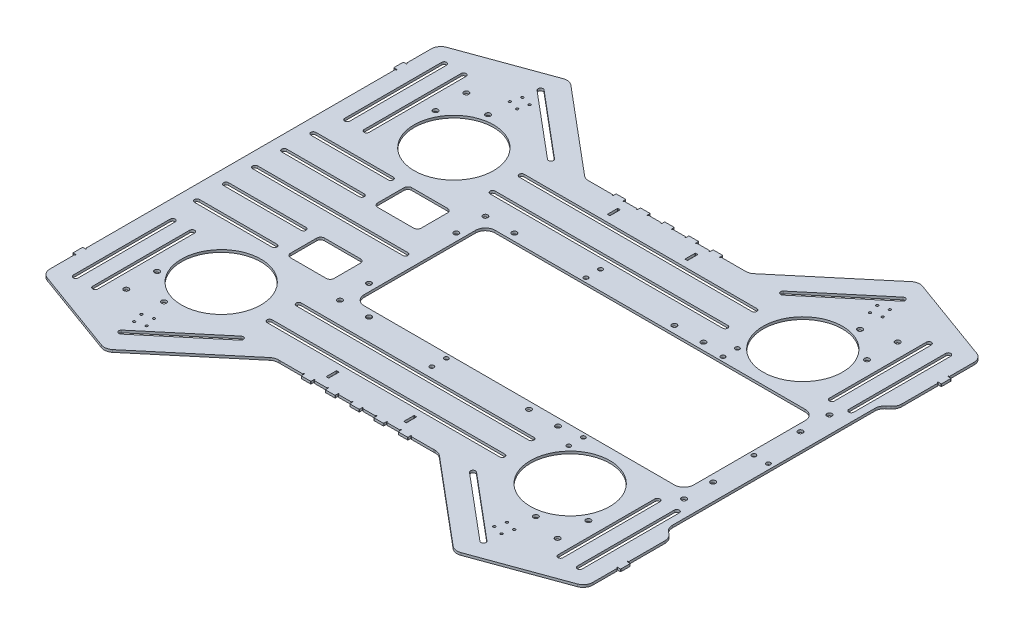
from build123d import *

# Parameters (mm, degrees)
SKETCH1_R                         = 1.575
SKETCH1_R_2                       = 52.07
SHEET_METAL_EXTRUDE_DEPTH         = 3.175
SHAPE_FILLET_R                    = 12.7
SKETCH2_R                         = 3.2639
PV_MOUNT_PATTERN_DEPTH            = 468.231899887
SKETCH3_R                         = 3.2639
THRUSTER_MOUNT_HOLE_PATTERN_DEPTH = 468.231899887
SKETCH5_W                         = 12.7
SKETCH5_H                         = 3.175
BOSS_EXTRUDE4_DEPTH               = 3.175
CUT_EXTRUDE3_DEPTH                = 468.231899887
LPATTERN1_COUNT                   = 5
LPATTERN1_PITCH                   = 31.75
MIRROR3_COPY_1_DEPTH              = 468.231899887
MIRROR3_COPY_2_DEPTH              = 468.231899887
MIRROR3_COPY_3_DEPTH              = 468.231899887
MIRROR3_COPY_4_DEPTH              = 468.231899887
FILLET_FOR_CUTTER_2_R             = 0.508
FILLET_FOR_CUTTER_R               = 0.508
CUT_EXTRUDE4_REACH                = 469.232
SKETCH8_W                         = 3.3528
SKETCH8_H                         = 13.716
FILLET3_R                         = 0.508
SKETCH9_W                         = 12.7
SKETCH9_H                         = 3.175
BOSS_EXTRUDE5_DEPTH               = 3.175
CUT_EXTRUDE5_DEPTH                = 3.175
MIRROR5_COPY_1_DEPTH              = 3.175
FILLET5_R                         = 0.508
SIDE_MOUNTING_SLOTS_DEPTH         = 470.652838698
BACK_MOUNTING_SLOTS_DEPTH         = 470.652838698
CUT_EXTRUDE8_DEPTH                = 470.652838698
MIRROR8_COPY_1_DEPTH              = 470.652838698
CUT_EXTRUDE9_DEPTH                = 470.652838698
CUT_EXTRUDE10_DEPTH               = 470.652838698
FILLET6_R                         = 0.254
FILLET6_OF_MIRROR9_R              = 0.254
MIRROR10_DEPTH                    = 3.175
CUT_EXTRUDE11_REACH               = 471.653
SKETCH16_R                        = 2.75


# Read off the part's stored shape, not the designer's step: Mirror10
with BuildPart() as part:
    # Sketch1 → Sheet Metal Extrude (new body)
    with BuildSketch(Plane(origin=(0, 0, 0), x_dir=(1, 0, 0), z_dir=(0, 1, 0))):
        Polygon((-355.6, -258.575780248), (-228.6, -304.8), (-107.517834992, -203.2), (107.517834992, -203.2), (228.6, -304.8), (355.6, -258.575780248), (355.6, -149.225), (342.9, -138.568434684), (342.9, 138.568434684), (355.6, 149.225), (355.6, 258.575780248), (228.6, 304.8), (107.517834992, 203.2), (-107.517834992, 203.2), (-228.6, 304.8), (-355.6, 258.575780248), (-355.6, 149.225), (-355.6, -149.225), align=None)
        with Locations((-240.704026872, -254.319069628)):
            Circle(SKETCH1_R, mode=Mode.SUBTRACT)
        with Locations((-227.726785536, -250.841828292)):
            Circle(SKETCH1_R, mode=Mode.SUBTRACT)
        with Locations((-244.181268208, -241.341828292)):
            Circle(SKETCH1_R, mode=Mode.SUBTRACT)
        with Locations((-231.204026872, -237.864586956)):
            Circle(SKETCH1_R, mode=Mode.SUBTRACT)
        with Locations((-228.6, -152.4)):
            Circle(SKETCH1_R_2, mode=Mode.SUBTRACT)
        with Locations((227.726785536, -250.841828292)):
            Circle(SKETCH1_R, mode=Mode.SUBTRACT)
        with Locations((240.704026872, -254.319069628)):
            Circle(SKETCH1_R, mode=Mode.SUBTRACT)
        with Locations((244.181268208, -241.341828292)):
            Circle(SKETCH1_R, mode=Mode.SUBTRACT)
        with Locations((231.204026872, -237.864586956)):
            Circle(SKETCH1_R, mode=Mode.SUBTRACT)
        with Locations((228.6, -152.4)):
            Circle(SKETCH1_R_2, mode=Mode.SUBTRACT)
        with Locations((-228.6, 152.4)):
            Circle(SKETCH1_R_2, mode=Mode.SUBTRACT)
        with Locations((-231.204026872, 237.864586956)):
            Circle(SKETCH1_R, mode=Mode.SUBTRACT)
        with Locations((-244.181268208, 241.341828292)):
            Circle(SKETCH1_R, mode=Mode.SUBTRACT)
        with Locations((-240.704026872, 254.319069628)):
            Circle(SKETCH1_R, mode=Mode.SUBTRACT)
        with Locations((-227.726785536, 250.841828292)):
            Circle(SKETCH1_R, mode=Mode.SUBTRACT)
        with Locations((228.6, 152.4)):
            Circle(SKETCH1_R_2, mode=Mode.SUBTRACT)
        with Locations((231.204026872, 237.864586956)):
            Circle(SKETCH1_R, mode=Mode.SUBTRACT)
        with Locations((244.181268208, 241.341828292)):
            Circle(SKETCH1_R, mode=Mode.SUBTRACT)
        with Locations((227.726785536, 250.841828292)):
            Circle(SKETCH1_R, mode=Mode.SUBTRACT)
        with Locations((240.704026872, 254.319069628)):
            Circle(SKETCH1_R, mode=Mode.SUBTRACT)
    extrude(amount=SHEET_METAL_EXTRUDE_DEPTH)

    # Shape Fillet
    shape_fillet_edges = [part.edges().sort_by_distance(p)[0] for p in [
        (228.6, 1.5875, -304.8),
        (355.6, 1.5875, -258.575780248),
        (355.6, 1.5875, -149.225),
        (342.9, 1.5875, -138.568434684),
        (342.9, 1.5875, 138.568434684),
        (355.6, 1.5875, 149.225),
        (355.6, 1.5875, 258.575780248),
        (228.6, 1.5875, 304.8),
        (107.517834992, 1.5875, 203.2),
        (-107.517834992, 1.5875, 203.2),
        (-228.6, 1.5875, 304.8),
        (-355.6, 1.5875, 258.575780248),
        (-355.6, 1.5875, -258.575780248),
        (-228.6, 1.5875, -304.8),
        (-107.517834992, 1.5875, -203.2),
        (107.517834992, 1.5875, -203.2),
    ]]
    fillet(shape_fillet_edges, radius=SHAPE_FILLET_R)

    # Sketch2 → PV Mount Pattern (cut, through all)
    with BuildSketch(Plane(origin=(0, 3.175, 0), x_dir=(1, 0, 0), z_dir=(0, 1, 0))):
        with Locations(Location((320.675, 95.25, 0), (0, 0, 270))):
            Circle(SKETCH2_R)
        with Locations(Location((320.675, 57.15, 0), (0, 0, 270))):
            Circle(SKETCH2_R)
        with Locations(Location((155.575, 95.25, 0), (0, 0, 270))):
            Circle(SKETCH2_R)
        with Locations(Location((117.475, 95.25, 0), (0, 0, 270))):
            Circle(SKETCH2_R)
        with Locations(Location((-92.075, 95.25, 0), (0, 0, 270))):
            Circle(SKETCH2_R)
        with Locations(Location((-130.175, 95.25, 0), (0, 0, 270))):
            Circle(SKETCH2_R)
        with Locations(Location((-130.175, 57.15, 0), (0, 0, 270))):
            Circle(SKETCH2_R)
        with Locations(Location((320.675, -57.15, 0), (0, 0, 90))):
            Circle(SKETCH2_R)
        with Locations(Location((320.675, -95.25, 0), (0, 0, 90))):
            Circle(SKETCH2_R)
        with Locations(Location((155.575, -95.25, 0), (0, 0, 90))):
            Circle(SKETCH2_R)
        with Locations(Location((117.475, -95.25, 0), (0, 0, 90))):
            Circle(SKETCH2_R)
        with Locations(Location((-92.075, -95.25, 0), (0, 0, 90))):
            Circle(SKETCH2_R)
        with Locations(Location((-130.175, -95.25, 0), (0, 0, 90))):
            Circle(SKETCH2_R)
        with Locations(Location((-130.175, -57.15, 0), (0, 0, 90))):
            Circle(SKETCH2_R)
        with BuildLine():
            Line((-107.95, 85.725), (298.45, 85.725))
            ThreePointArc((298.45, 85.725), (307.430256121, 82.005256121), (311.15, 73.025))
            Line((311.15, 73.025), (311.15, -73.025))
            ThreePointArc((311.15, -73.025), (307.430256121, -82.005256121), (298.45, -85.725))
            Line((298.45, -85.725), (-107.95, -85.725))
            ThreePointArc((-107.95, -85.725), (-116.930256121, -82.005256121), (-120.65, -73.025))
            Line((-120.65, -73.025), (-120.65, 73.025))
            ThreePointArc((-120.65, 73.025), (-116.930256121, 82.005256121), (-107.95, 85.725))
        make_face()
    extrude(amount=-PV_MOUNT_PATTERN_DEPTH, mode=Mode.SUBTRACT)

    # Sketch3 → Thruster Mount Hole Pattern (cut, through all)
    with BuildSketch(Plane(origin=(0, 3.175, 0), x_dir=(1, 0, 0), z_dir=(0, 1, 0))):
        with Locations(Location((282.589529262, 222.760524402, 0), (0, 0, 270))):
            Circle(SKETCH3_R)
        with Locations(Location((-282.589529262, 222.760524402, 0), (0, 0, 270))):
            Circle(SKETCH3_R)
        with Locations(Location((282.589529262, -222.760524402, 0), (0, 0, 90))):
            Circle(SKETCH3_R)
        with Locations(Location((-282.589529262, -222.760524402, 0), (0, 0, 90))):
            Circle(SKETCH3_R)
        with Locations(Location((282.589529262, 182.458174715, 0), (0, 0, 270))):
            Circle(SKETCH3_R)
        with Locations(Location((243.660448839, 212.329508741, 0), (0, 0, 270))):
            Circle(SKETCH3_R)
        with Locations(Location((-243.660448839, 212.329508741, 0), (0, 0, 270))):
            Circle(SKETCH3_R)
        with Locations(Location((-282.589529262, 182.458174715, 0), (0, 0, 270))):
            Circle(SKETCH3_R)
        with Locations(Location((243.660448839, -212.329508741, 0), (0, 0, 90))):
            Circle(SKETCH3_R)
        with Locations(Location((282.589529262, -182.458174715, 0), (0, 0, 90))):
            Circle(SKETCH3_R)
        with Locations(Location((-282.589529262, -182.458174715, 0), (0, 0, 90))):
            Circle(SKETCH3_R)
        with Locations(Location((-243.660448839, -212.329508741, 0), (0, 0, 90))):
            Circle(SKETCH3_R)
    extrude(amount=-THRUSTER_MOUNT_HOLE_PATTERN_DEPTH, mode=Mode.SUBTRACT)

    # Sketch5 → Boss-Extrude4 (add)
    with BuildSketch(Plane.XY.offset(203.2)):
        with Locations((0, 1.5875)):
            Rectangle(SKETCH5_W, SKETCH5_H)
        with Locations((31.75, 1.5875)):
            Rectangle(SKETCH5_W, SKETCH5_H)
        with Locations((63.5, 1.5875)):
            Rectangle(SKETCH5_W, SKETCH5_H)
        with Locations((-31.75, 1.5875)):
            Rectangle(SKETCH5_W, SKETCH5_H)
        with Locations((-63.5, 1.5875)):
            Rectangle(SKETCH5_W, SKETCH5_H)
    boss_extrude4 = extrude(amount=BOSS_EXTRUDE4_DEPTH)

    # Mirror2: Boss-Extrude4 across plane
    add(boss_extrude4.mirror(Plane.XY))

    # Sketch6 → Cut-Extrude3 (cut, through all)
    with BuildSketch(Plane(origin=(0, 3.175, 0), x_dir=(1, 0, 0), z_dir=(0, 1, 0))):
        with BuildLine():
            Line((69.85, 202.438), (69.85, 203.2))
            Line((69.85, 203.2), (70.866, 203.2))
            Line((70.866, 203.2), (70.866, 202.438))
            ThreePointArc((70.866, 202.438), (70.358, 201.93), (69.85, 202.438))
        make_face()
        with BuildLine():
            Line((56.134, 202.438), (56.134, 203.2))
            Line((56.134, 203.2), (57.15, 203.2))
            Line((57.15, 203.2), (57.15, 202.438))
            ThreePointArc((57.15, 202.438), (56.642, 201.93), (56.134, 202.438))
        make_face()
    cut_extrude3 = extrude(amount=-CUT_EXTRUDE3_DEPTH, mode=Mode.SUBTRACT)

    # LPattern1: Cut-Extrude3 ×5
    with Locations(*[(-i * LPATTERN1_PITCH, 0, 0) for i in range(1, LPATTERN1_COUNT)]):
        add(cut_extrude3, mode=Mode.SUBTRACT)

    # Mirror3: Cut-Extrude3 across plane
    add(cut_extrude3.mirror(Plane.XY), mode=Mode.SUBTRACT)

    # Mirror3 copy 1 sketch → Mirror3 copy 1 (cut, through all)
    with BuildSketch(Plane(origin=(-31.75, 3.175, 0), x_dir=(1, 0, 0), z_dir=(0, 1, 0))):
        with BuildLine():
            Line((69.85, -202.438), (69.85, -203.2))
            Line((69.85, -203.2), (70.866, -203.2))
            Line((70.866, -203.2), (70.866, -202.438))
            ThreePointArc((70.866, -202.438), (70.358, -201.93), (69.85, -202.438))
        make_face()
        with BuildLine():
            Line((56.134, -202.438), (56.134, -203.2))
            Line((56.134, -203.2), (57.15, -203.2))
            Line((57.15, -203.2), (57.15, -202.438))
            ThreePointArc((57.15, -202.438), (56.642, -201.93), (56.134, -202.438))
        make_face()
    extrude(amount=-MIRROR3_COPY_1_DEPTH, mode=Mode.SUBTRACT)

    # Mirror3 copy 2 sketch → Mirror3 copy 2 (cut, through all)
    with BuildSketch(Plane(origin=(-63.5, 3.175, 0), x_dir=(1, 0, 0), z_dir=(0, 1, 0))):
        with BuildLine():
            Line((69.85, -202.438), (69.85, -203.2))
            Line((69.85, -203.2), (70.866, -203.2))
            Line((70.866, -203.2), (70.866, -202.438))
            ThreePointArc((70.866, -202.438), (70.358, -201.93), (69.85, -202.438))
        make_face()
        with BuildLine():
            Line((56.134, -202.438), (56.134, -203.2))
            Line((56.134, -203.2), (57.15, -203.2))
            Line((57.15, -203.2), (57.15, -202.438))
            ThreePointArc((57.15, -202.438), (56.642, -201.93), (56.134, -202.438))
        make_face()
    extrude(amount=-MIRROR3_COPY_2_DEPTH, mode=Mode.SUBTRACT)

    # Mirror3 copy 3 sketch → Mirror3 copy 3 (cut, through all)
    with BuildSketch(Plane(origin=(-95.25, 3.175, 0), x_dir=(1, 0, 0), z_dir=(0, 1, 0))):
        with BuildLine():
            Line((69.85, -202.438), (69.85, -203.2))
            Line((69.85, -203.2), (70.866, -203.2))
            Line((70.866, -203.2), (70.866, -202.438))
            ThreePointArc((70.866, -202.438), (70.358, -201.93), (69.85, -202.438))
        make_face()
        with BuildLine():
            Line((56.134, -202.438), (56.134, -203.2))
            Line((56.134, -203.2), (57.15, -203.2))
            Line((57.15, -203.2), (57.15, -202.438))
            ThreePointArc((57.15, -202.438), (56.642, -201.93), (56.134, -202.438))
        make_face()
    extrude(amount=-MIRROR3_COPY_3_DEPTH, mode=Mode.SUBTRACT)

    # Mirror3 copy 4 sketch → Mirror3 copy 4 (cut, through all)
    with BuildSketch(Plane(origin=(-127, 3.175, 0), x_dir=(1, 0, 0), z_dir=(0, 1, 0))):
        with BuildLine():
            Line((69.85, -202.438), (69.85, -203.2))
            Line((69.85, -203.2), (70.866, -203.2))
            Line((70.866, -203.2), (70.866, -202.438))
            ThreePointArc((70.866, -202.438), (70.358, -201.93), (69.85, -202.438))
        make_face()
        with BuildLine():
            Line((56.134, -202.438), (56.134, -203.2))
            Line((56.134, -203.2), (57.15, -203.2))
            Line((57.15, -203.2), (57.15, -202.438))
            ThreePointArc((57.15, -202.438), (56.642, -201.93), (56.134, -202.438))
        make_face()
    extrude(amount=-MIRROR3_COPY_4_DEPTH, mode=Mode.SUBTRACT)

    # Fillet for Cutter 2
    fillet_for_cutter_2_edges = [part.edges().sort_by_distance(p)[0] for p in [
        (-6.35, 1.5875, 206.375),
        (6.35, 1.5875, 206.375),
        (-38.1, 1.5875, 206.375),
        (-25.4, 1.5875, 206.375),
        (25.4, 1.5875, 206.375),
        (38.1, 1.5875, 206.375),
        (57.15, 1.5875, 206.375),
        (69.85, 1.5875, 206.375),
        (-69.85, 1.5875, 206.375),
        (-57.15, 1.5875, 206.375),
        (70.866, 1.5875, 203.2),
        (56.134, 1.5875, 203.2),
        (39.116, 1.5875, 203.2),
        (24.384, 1.5875, 203.2),
        (7.366, 1.5875, 203.2),
        (-7.366, 1.5875, 203.2),
        (-24.384, 1.5875, 203.2),
        (-39.116, 1.5875, 203.2),
        (-56.134, 1.5875, 203.2),
        (-70.866, 1.5875, 203.2),
    ]]
    fillet(fillet_for_cutter_2_edges, radius=FILLET_FOR_CUTTER_2_R)

    # Fillet for Cutter
    fillet_for_cutter_edges = [part.edges().sort_by_distance(p)[0] for p in [
        (-6.35, 1.5875, -206.375),
        (6.35, 1.5875, -206.375),
        (-25.4, 1.5875, -206.375),
        (-38.1, 1.5875, -206.375),
        (38.1, 1.5875, -206.375),
        (25.4, 1.5875, -206.375),
        (69.85, 1.5875, -206.375),
        (57.15, 1.5875, -206.375),
        (-57.15, 1.5875, -206.375),
        (-69.85, 1.5875, -206.375),
        (70.866, 1.5875, -203.2),
        (56.134, 1.5875, -203.2),
        (39.116, 1.5875, -203.2),
        (24.384, 1.5875, -203.2),
        (-7.366, 1.5875, -203.2),
        (-24.384, 1.5875, -203.2),
        (-39.116, 1.5875, -203.2),
        (-56.134, 1.5875, -203.2),
        (-70.866, 1.5875, -203.2),
    ]]
    fillet(fillet_for_cutter_edges, radius=FILLET_FOR_CUTTER_R)

    # Sketch8 → Cut-Extrude4 (cut, up to next)
    with BuildSketch(Plane(origin=(0, 3.175, 0), x_dir=(1, 0, 0), z_dir=(0, 1, 0)), mode=Mode.PRIVATE) as cut_extrude4_sk1:
        with Locations((50.8, 184.15)):
            Rectangle(SKETCH8_W, SKETCH8_H)
    cut_extrude4_tool1 = extrude(cut_extrude4_sk1.sketch, amount=-CUT_EXTRUDE4_REACH, mode=Mode.PRIVATE) & part.part
    # Sketch8 → Cut-Extrude4 (cut, up to next)
    with BuildSketch(Plane(origin=(0, 3.175, 0), x_dir=(1, 0, 0), z_dir=(0, 1, 0)), mode=Mode.PRIVATE) as cut_extrude4_sk2:
        with Locations((-50.8, 184.15)):
            Rectangle(SKETCH8_W, SKETCH8_H)
    cut_extrude4_tool2 = extrude(cut_extrude4_sk2.sketch, amount=-CUT_EXTRUDE4_REACH, mode=Mode.PRIVATE) & part.part
    # Sketch8 → Cut-Extrude4 (cut, up to next)
    with BuildSketch(Plane(origin=(0, 3.175, 0), x_dir=(1, 0, 0), z_dir=(0, 1, 0)), mode=Mode.PRIVATE) as cut_extrude4_sk3:
        with Locations((-50.8, -184.15)):
            Rectangle(SKETCH8_W, SKETCH8_H)
    cut_extrude4_tool3 = extrude(cut_extrude4_sk3.sketch, amount=-CUT_EXTRUDE4_REACH, mode=Mode.PRIVATE) & part.part
    # Sketch8 → Cut-Extrude4 (cut, up to next)
    with BuildSketch(Plane(origin=(0, 3.175, 0), x_dir=(1, 0, 0), z_dir=(0, 1, 0)), mode=Mode.PRIVATE) as cut_extrude4_sk4:
        with Locations((50.8, -184.15)):
            Rectangle(SKETCH8_W, SKETCH8_H)
    cut_extrude4_tool4 = extrude(cut_extrude4_sk4.sketch, amount=-CUT_EXTRUDE4_REACH, mode=Mode.PRIVATE) & part.part
    add(cut_extrude4_tool1.solids().sort_by_distance((50.8, 3.175, -184.15))[0], mode=Mode.SUBTRACT)
    add(cut_extrude4_tool2.solids().sort_by_distance((-50.8, 3.175, -184.15))[0], mode=Mode.SUBTRACT)
    add(cut_extrude4_tool3.solids().sort_by_distance((-50.8, 3.175, 184.15))[0], mode=Mode.SUBTRACT)
    add(cut_extrude4_tool4.solids().sort_by_distance((50.8, 3.175, 184.15))[0], mode=Mode.SUBTRACT)

    # Fillet3
    fillet3_edges = [part.edges().sort_by_distance(p)[0] for p in [
        (52.4764, 1.5875, 177.292),
        (52.4764, 1.5875, 191.008),
        (49.1236, 1.5875, 191.008),
        (49.1236, 1.5875, 177.292),
        (-52.4764, 1.5875, 191.008),
        (-52.4764, 1.5875, 177.292),
        (-49.1236, 1.5875, 177.292),
        (-49.1236, 1.5875, 191.008),
        (-52.4764, 1.5875, -177.292),
        (-52.4764, 1.5875, -191.008),
        (-49.1236, 1.5875, -191.008),
        (-49.1236, 1.5875, -177.292),
        (49.1236, 1.5875, -177.292),
        (49.1236, 1.5875, -191.008),
        (52.4764, 1.5875, -191.008),
        (52.4764, 1.5875, -177.292),
    ]]
    fillet(fillet3_edges, radius=FILLET3_R)

    # Sketch9 → Boss-Extrude5 (add)
    with BuildSketch(Plane(origin=(355.6, 0, 0), x_dir=(0, 0, -1), z_dir=(1, 0, 0))):
        with Locations((210.058, 1.5875)):
            Rectangle(SKETCH9_W, SKETCH9_H)
        with Locations((-210.058, 1.5875)):
            Rectangle(SKETCH9_W, SKETCH9_H)
    boss_extrude5 = extrude(amount=BOSS_EXTRUDE5_DEPTH)

    # Sketch10 → Cut-Extrude5 (cut)
    with BuildSketch(Plane(origin=(0, 3.175, 0), x_dir=(1, 0, 0), z_dir=(0, 1, 0))):
        with BuildLine():
            Line((354.838, -217.424), (355.6, -217.424))
            Line((355.6, -217.424), (355.6, -216.408))
            Line((355.6, -216.408), (354.838, -216.408))
            ThreePointArc((354.838, -216.408), (354.33, -216.916), (354.838, -217.424))
        make_face()
        with BuildLine():
            Line((354.838, -202.692), (355.6, -202.692))
            Line((355.6, -202.692), (355.6, -203.708))
            Line((355.6, -203.708), (354.838, -203.708))
            ThreePointArc((354.838, -203.708), (354.33, -203.2), (354.838, -202.692))
        make_face()
    cut_extrude5 = extrude(amount=-CUT_EXTRUDE5_DEPTH, mode=Mode.SUBTRACT)

    # Mirror4: Cut-Extrude5 across plane
    add(cut_extrude5.mirror(Plane.XY), mode=Mode.SUBTRACT)

    # Mirror5: Boss-Extrude5, Cut-Extrude5 across plane
    add(boss_extrude5.mirror(Plane(origin=(0, 0, 0), x_dir=(0, 0, 1), z_dir=(1, 0, 0))))
    add(cut_extrude5.mirror(Plane(origin=(0, 0, 0), x_dir=(0, 0, 1), z_dir=(1, 0, 0))), mode=Mode.SUBTRACT)

    # Mirror5 copy 1 sketch → Mirror5 copy 1 (cut)
    with BuildSketch(Plane(origin=(0, 3.175, 0), x_dir=(-1, 0, 0), z_dir=(0, 1, 0))):
        with BuildLine():
            Line((354.838, -217.424), (355.6, -217.424))
            Line((355.6, -217.424), (355.6, -216.408))
            Line((355.6, -216.408), (354.838, -216.408))
            ThreePointArc((354.838, -216.408), (354.33, -216.916), (354.838, -217.424))
        make_face()
        with BuildLine():
            Line((354.838, -202.692), (355.6, -202.692))
            Line((355.6, -202.692), (355.6, -203.708))
            Line((355.6, -203.708), (354.838, -203.708))
            ThreePointArc((354.838, -203.708), (354.33, -203.2), (354.838, -202.692))
        make_face()
    extrude(amount=-MIRROR5_COPY_1_DEPTH, mode=Mode.SUBTRACT)

    # Fillet5
    fillet5_edges = [part.edges().sort_by_distance(p)[0] for p in [
        (358.775, 1.5875, -203.708),
        (358.775, 1.5875, -216.408),
        (358.775, 1.5875, 216.408),
        (358.775, 1.5875, 203.708),
        (355.6, 1.5875, 217.424),
        (355.6, 1.5875, 202.692),
        (355.6, 1.5875, -217.424),
        (355.6, 1.5875, -202.692),
        (-358.775, 1.5875, -203.708),
        (-358.775, 1.5875, -216.408),
        (-358.775, 1.5875, 203.708),
        (-358.775, 1.5875, 216.408),
        (-355.6, 1.5875, 217.424),
        (-355.6, 1.5875, 202.692),
        (-355.6, 1.5875, -217.424),
        (-355.6, 1.5875, -202.692),
    ]]
    fillet(fillet5_edges, radius=FILLET5_R)

    # Sketch11 → Side Mounting Slots (cut, through all)
    with BuildSketch(Plane(origin=(0, 3.175, 0), x_dir=(1, 0, 0), z_dir=(0, 1, 0))):
        with BuildLine():
            Line((152.4, 168.3639), (-152.4, 168.3639))
            ThreePointArc((-152.4, 168.3639), (-155.6639, 165.1), (-152.4, 161.8361))
            Line((-152.4, 161.8361), (152.4, 161.8361))
            ThreePointArc((152.4, 161.8361), (155.6639, 165.1), (152.4, 168.3639))
        make_face()
        with BuildLine():
            Line((-152.4, 123.7361), (152.4, 123.7361))
            ThreePointArc((152.4, 123.7361), (155.6639, 127), (152.4, 130.2639))
            Line((152.4, 130.2639), (-152.4, 130.2639))
            ThreePointArc((-152.4, 130.2639), (-155.6639, 127), (-152.4, 123.7361))
        make_face()
    side_mounting_slots = extrude(amount=-SIDE_MOUNTING_SLOTS_DEPTH, mode=Mode.SUBTRACT)

    # Mirror6: Side Mounting Slots across plane
    add(side_mounting_slots.mirror(Plane.XY), mode=Mode.SUBTRACT)

    # Sketch12 → Back Mounting Slots (cut, through all)
    with BuildSketch(Plane(origin=(0, 3.175, 0), x_dir=(1, 0, 0), z_dir=(0, 1, 0))):
        with BuildLine():
            Line((-139.7, -3.2639), (-336.55, -3.2639))
            ThreePointArc((-336.55, -3.2639), (-339.8139, 0), (-336.55, 3.2639))
            Line((-336.55, 3.2639), (-139.7, 3.2639))
            ThreePointArc((-139.7, 3.2639), (-136.4361, 0), (-139.7, -3.2639))
        make_face()
        with BuildLine():
            Line((-215.9, -74.3839), (-215.9, -39.9161))
            ThreePointArc((-215.9, -39.9161), (-214.412102448, -36.323997552), (-210.82, -34.8361))
            Line((-210.82, -34.8361), (-163.83, -34.8361))
            ThreePointArc((-163.83, -34.8361), (-160.237897552, -36.323997552), (-158.75, -39.9161))
            Line((-158.75, -39.9161), (-158.75, -74.3839))
            ThreePointArc((-158.75, -74.3839), (-160.237897552, -77.976002448), (-163.83, -79.4639))
            Line((-163.83, -79.4639), (-210.82, -79.4639))
            ThreePointArc((-210.82, -79.4639), (-214.412102448, -77.976002448), (-215.9, -74.3839))
        make_face()
        with BuildLine():
            Line((-336.55, 41.3639), (-234.95, 41.3639))
            ThreePointArc((-234.95, 41.3639), (-231.6861, 38.1), (-234.95, 34.8361))
            Line((-234.95, 34.8361), (-336.55, 34.8361))
            ThreePointArc((-336.55, 34.8361), (-339.8139, 38.1), (-336.55, 41.3639))
        make_face()
        with BuildLine():
            Line((-336.55, 79.4639), (-234.95, 79.4639))
            ThreePointArc((-234.95, 79.4639), (-231.6861, 76.2), (-234.95, 72.9361))
            Line((-234.95, 72.9361), (-336.55, 72.9361))
            ThreePointArc((-336.55, 72.9361), (-339.8139, 76.2), (-336.55, 79.4639))
        make_face()
        with BuildLine():
            Line((-336.55, -41.3639), (-234.95, -41.3639))
            ThreePointArc((-234.95, -41.3639), (-231.6861, -38.1), (-234.95, -34.8361))
            Line((-234.95, -34.8361), (-336.55, -34.8361))
            ThreePointArc((-336.55, -34.8361), (-339.8139, -38.1), (-336.55, -41.3639))
        make_face()
        with BuildLine():
            Line((-336.55, -72.9361), (-234.95, -72.9361))
            ThreePointArc((-234.95, -72.9361), (-231.6861, -76.2), (-234.95, -79.4639))
            Line((-234.95, -79.4639), (-336.55, -79.4639))
            ThreePointArc((-336.55, -79.4639), (-339.8139, -76.2), (-336.55, -72.9361))
        make_face()
        with BuildLine():
            Line((-163.83, 79.4639), (-210.82, 79.4639))
            ThreePointArc((-210.82, 79.4639), (-214.412102448, 77.976002448), (-215.9, 74.3839))
            Line((-215.9, 74.3839), (-215.9, 39.9161))
            ThreePointArc((-215.9, 39.9161), (-214.412102448, 36.323997552), (-210.82, 34.8361))
            Line((-210.82, 34.8361), (-163.83, 34.8361))
            ThreePointArc((-163.83, 34.8361), (-160.237897552, 36.323997552), (-158.75, 39.9161))
            Line((-158.75, 39.9161), (-158.75, 74.3839))
            ThreePointArc((-158.75, 74.3839), (-160.237897552, 77.976002448), (-163.83, 79.4639))
        make_face()
    extrude(amount=-BACK_MOUNTING_SLOTS_DEPTH, mode=Mode.SUBTRACT)

    # Sketch13 → Cut-Extrude8 (cut, through all)
    with BuildSketch(Plane.XZ):
        with BuildLine():
            Line((-326.9361, 241.3), (-326.9361, 114.3))
            ThreePointArc((-326.9361, 114.3), (-330.2, 111.0361), (-333.4639, 114.3))
            Line((-333.4639, 114.3), (-333.4639, 241.3))
            ThreePointArc((-333.4639, 241.3), (-330.2, 244.5639), (-326.9361, 241.3))
        make_face()
        with BuildLine():
            Line((-308.0639, 241.3), (-308.0639, 114.3))
            ThreePointArc((-308.0639, 114.3), (-304.8, 111.0361), (-301.5361, 114.3))
            Line((-301.5361, 114.3), (-301.5361, 241.3))
            ThreePointArc((-301.5361, 241.3), (-304.8, 244.5639), (-308.0639, 241.3))
        make_face()
    cut_extrude8 = extrude(amount=-CUT_EXTRUDE8_DEPTH, mode=Mode.SUBTRACT)

    # Mirror7: Cut-Extrude8 across plane
    add(cut_extrude8.mirror(Plane(origin=(0, 0, 0), x_dir=(0, 0, 1), z_dir=(1, 0, 0))), mode=Mode.SUBTRACT)

    # Mirror8: Cut-Extrude8 across plane
    add(cut_extrude8.mirror(Plane.XY), mode=Mode.SUBTRACT)

    # Mirror8 copy 1 sketch → Mirror8 copy 1 (cut, through all)
    with BuildSketch(Plane(origin=(0, 0, 0), x_dir=(-1, 0, 0), z_dir=(0, -1, 0))):
        with BuildLine():
            Line((-326.9361, 241.3), (-326.9361, 114.3))
            ThreePointArc((-326.9361, 114.3), (-330.2, 111.0361), (-333.4639, 114.3))
            Line((-333.4639, 114.3), (-333.4639, 241.3))
            ThreePointArc((-333.4639, 241.3), (-330.2, 244.5639), (-326.9361, 241.3))
        make_face()
        with BuildLine():
            Line((-308.0639, 241.3), (-308.0639, 114.3))
            ThreePointArc((-308.0639, 114.3), (-304.8, 111.0361), (-301.5361, 114.3))
            Line((-301.5361, 114.3), (-301.5361, 241.3))
            ThreePointArc((-301.5361, 241.3), (-304.8, 244.5639), (-308.0639, 241.3))
        make_face()
    extrude(amount=-MIRROR8_COPY_1_DEPTH, mode=Mode.SUBTRACT)

    # Sketch14 → Cut-Extrude9 (cut, through all)
    with BuildSketch(Plane(origin=(0, 0, 0), x_dir=(-1, 0, 0), z_dir=(0, -1, 0))):
        with BuildLine():
            Line((-235.136540287, 277.127463395), (-150.012952714, 205.700292458))
            ThreePointArc((-150.012952714, 205.700292458), (-149.610654735, 201.102005521), (-154.208941672, 200.699707542))
            Line((-154.208941672, 200.699707542), (-239.332529246, 272.126878479))
            ThreePointArc((-239.332529246, 272.126878479), (-239.734827224, 276.725165417), (-235.136540287, 277.127463395))
        make_face()
        with BuildLine():
            Line((-239.332529246, -272.126878479), (-154.208941672, -200.699707542))
            ThreePointArc((-154.208941672, -200.699707542), (-149.610654735, -201.102005521), (-150.012952714, -205.700292458))
            Line((-150.012952714, -205.700292458), (-235.136540287, -277.127463395))
            ThreePointArc((-235.136540287, -277.127463395), (-239.734827224, -276.725165417), (-239.332529246, -272.126878479))
        make_face()
        with BuildLine():
            Line((235.136540287, -277.127463395), (150.012952714, -205.700292458))
            ThreePointArc((150.012952714, -205.700292458), (149.610654735, -201.102005521), (154.208941672, -200.699707542))
            Line((154.208941672, -200.699707542), (239.332529246, -272.126878479))
            ThreePointArc((239.332529246, -272.126878479), (239.734827224, -276.725165417), (235.136540287, -277.127463395))
        make_face()
        with BuildLine():
            Line((239.332529246, 272.126878479), (154.208941672, 200.699707542))
            ThreePointArc((154.208941672, 200.699707542), (149.610654735, 201.102005521), (150.012952714, 205.700292458))
            Line((150.012952714, 205.700292458), (235.136540287, 277.127463395))
            ThreePointArc((235.136540287, 277.127463395), (239.734827224, 276.725165417), (239.332529246, 272.126878479))
        make_face()
    extrude(amount=-CUT_EXTRUDE9_DEPTH, mode=Mode.SUBTRACT)

    # Sketch15 → Cut-Extrude10 (cut, through all)
    with BuildSketch(Plane(origin=(0, 3.175, 0), x_dir=(1, 0, 0), z_dir=(0, 1, 0))):
        Polygon((100.084767464, 203.2), (101.608767464, 202.9968), (101.608767464, 203.2), align=None)
    cut_extrude10 = extrude(amount=-CUT_EXTRUDE10_DEPTH, mode=Mode.SUBTRACT)

    # Fillet6
    # the kernel refuses this fillet: 0.254 mm, written as the material it adds along each edge
    with BuildSketch(Plane(origin=(101.608767464, 3.175, -202.9968), x_dir=(-0.9912279006826319, 0, -0.13216372009103824), z_dir=(0, -1, 0))) as fillet6_piece_1:
        with BuildLine():
            CenterArc((0.275353317, 0.254), FILLET6_R, 191.947637647, 78.052362353)
            Line((0.026855668, 0.201417509), (0.021885715, 0.20036586))
            ThreePointArc((0.021885715, 0.20036586), (0.008392396, 0.101380146), (-0.005035438, 0.000671392))
            Line((-0.005035438, 0.000671392), (0, -0.00508))
            Line((0, -0.00508), (0.275353317, -0.00508))
            Line((0.275353317, -0.00508), (0.275353317, 0))
        make_face()
    extrude(amount=3.175)

    # Mirror9: Cut-Extrude10 across plane
    add(cut_extrude10.mirror(Plane.XY), mode=Mode.SUBTRACT)

    # Fillet6 of Mirror9
    # the kernel refuses this fillet: 0.254 mm, written as the material it adds along each edge
    with BuildSketch(Plane(origin=(101.608767464, 3.175, 202.9968), x_dir=(0, 0, 1), z_dir=(0, -1, 0))) as fillet6_of_mirror9_piece_1:
        with BuildLine():
            CenterArc((0.288163606, 0.239368306), FILLET6_OF_MIRROR9_R, 172.405356631, 78.052362353)
            Line((0.036391719, 0.272937891), (0.031356281, 0.273609282))
            Line((0.031356281, 0.273609282), (-0.005035438, 0.000671392))
            Line((-0.005035438, 0.000671392), (0, -0.00508))
            ThreePointArc((0, -0.00508), (0.1016, -0.00508), (0.201500728, -0.004787366))
            Line((0.201500728, -0.004787366), (0.2032, 0))
        make_face()
    extrude(amount=3.175)

    # Mirror10 outline → Mirror10 (cut)
    with BuildSketch(Plane(origin=(0, 0, 0), x_dir=(1, 0, 0), z_dir=(0, 1, 0))):
        with BuildLine():
            Line((-101.335829573, 203.033191719), (-100.084767464, 203.2))
            Line((-100.084767464, 203.2), (-101.608767464, 203.2))
            ThreePointArc((-101.608767464, 203.2), (-101.501854921, 203.068234579), (-101.335829573, 203.033191719))
        make_face()
        with BuildLine():
            Line((-101.608767464, -203.2), (-100.084767464, -203.2))
            Line((-100.084767464, -203.2), (-101.335829573, -203.033191719))
            ThreePointArc((-101.335829573, -203.033191719), (-101.501854921, -203.068234579), (-101.608767464, -203.2))
        make_face()
    extrude(amount=MIRROR10_DEPTH, mode=Mode.SUBTRACT)

    # Sketch16 → Cut-Extrude11 (cut, up to next)
    with BuildSketch(Plane(origin=(0, 0, 0), x_dir=(-1, 0, 0), z_dir=(0, -1, 0)), mode=Mode.PRIVATE) as cut_extrude11_sk1:
        with Locations(Location((-184.888055827, 91.458807626, 0), (0, 0, 90))):
            Circle(SKETCH16_R)
    cut_extrude11_tool1 = extrude(cut_extrude11_sk1.sketch, amount=-CUT_EXTRUDE11_REACH, mode=Mode.PRIVATE) & part.part
    # Sketch16 → Cut-Extrude11 (cut, up to next)
    with BuildSketch(Plane(origin=(0, 0, 0), x_dir=(-1, 0, 0), z_dir=(0, -1, 0)), mode=Mode.PRIVATE) as cut_extrude11_sk2:
        with Locations(Location((-184.888055827, 110.508807626, 0), (0, 0, 90))):
            Circle(SKETCH16_R)
    cut_extrude11_tool2 = extrude(cut_extrude11_sk2.sketch, amount=-CUT_EXTRUDE11_REACH, mode=Mode.PRIVATE) & part.part
    # Sketch16 → Cut-Extrude11 (cut, up to next)
    with BuildSketch(Plane(origin=(0, 0, 0), x_dir=(-1, 0, 0), z_dir=(0, -1, 0)), mode=Mode.PRIVATE) as cut_extrude11_sk3:
        with Locations(Location((-335.933807626, 0, 0), (0, 0, 90))):
            Circle(SKETCH16_R)
    cut_extrude11_tool3 = extrude(cut_extrude11_sk3.sketch, amount=-CUT_EXTRUDE11_REACH, mode=Mode.PRIVATE) & part.part
    # Sketch16 → Cut-Extrude11 (cut, up to next)
    with BuildSketch(Plane(origin=(0, 0, 0), x_dir=(-1, 0, 0), z_dir=(0, -1, 0)), mode=Mode.PRIVATE) as cut_extrude11_sk4:
        with Locations(Location((-316.883807626, 0, 0), (0, 0, 90))):
            Circle(SKETCH16_R)
    cut_extrude11_tool4 = extrude(cut_extrude11_sk4.sketch, amount=-CUT_EXTRUDE11_REACH, mode=Mode.PRIVATE) & part.part
    # Sketch16 → Cut-Extrude11 (cut, up to next)
    with BuildSketch(Plane(origin=(0, 0, 0), x_dir=(-1, 0, 0), z_dir=(0, -1, 0)), mode=Mode.PRIVATE) as cut_extrude11_sk5:
        with Locations(Location((-184.888055827, -110.508807626, 0), (0, 0, 90))):
            Circle(SKETCH16_R)
    cut_extrude11_tool5 = extrude(cut_extrude11_sk5.sketch, amount=-CUT_EXTRUDE11_REACH, mode=Mode.PRIVATE) & part.part
    # Sketch16 → Cut-Extrude11 (cut, up to next)
    with BuildSketch(Plane(origin=(0, 0, 0), x_dir=(-1, 0, 0), z_dir=(0, -1, 0)), mode=Mode.PRIVATE) as cut_extrude11_sk6:
        with Locations(Location((-184.888055827, -91.458807626, 0), (0, 0, 90))):
            Circle(SKETCH16_R)
    cut_extrude11_tool6 = extrude(cut_extrude11_sk6.sketch, amount=-CUT_EXTRUDE11_REACH, mode=Mode.PRIVATE) & part.part
    # Sketch16 → Cut-Extrude11 (cut, up to next)
    with BuildSketch(Plane(origin=(0, 0, 0), x_dir=(-1, 0, 0), z_dir=(0, -1, 0)), mode=Mode.PRIVATE) as cut_extrude11_sk7:
        with Locations(Location((-5.449027914, -110.508807626, 0), (0, 0, 90))):
            Circle(SKETCH16_R)
    cut_extrude11_tool7 = extrude(cut_extrude11_sk7.sketch, amount=-CUT_EXTRUDE11_REACH, mode=Mode.PRIVATE) & part.part
    # Sketch16 → Cut-Extrude11 (cut, up to next)
    with BuildSketch(Plane(origin=(0, 0, 0), x_dir=(-1, 0, 0), z_dir=(0, -1, 0)), mode=Mode.PRIVATE) as cut_extrude11_sk8:
        with Locations(Location((-5.449027914, -91.458807626, 0), (0, 0, 90))):
            Circle(SKETCH16_R)
    cut_extrude11_tool8 = extrude(cut_extrude11_sk8.sketch, amount=-CUT_EXTRUDE11_REACH, mode=Mode.PRIVATE) & part.part
    # Sketch16 → Cut-Extrude11 (cut, up to next)
    with BuildSketch(Plane(origin=(0, 0, 0), x_dir=(-1, 0, 0), z_dir=(0, -1, 0)), mode=Mode.PRIVATE) as cut_extrude11_sk9:
        with Locations(Location((-5.449027914, 110.508807626, 0), (0, 0, 90))):
            Circle(SKETCH16_R)
    cut_extrude11_tool9 = extrude(cut_extrude11_sk9.sketch, amount=-CUT_EXTRUDE11_REACH, mode=Mode.PRIVATE) & part.part
    # Sketch16 → Cut-Extrude11 (cut, up to next)
    with BuildSketch(Plane(origin=(0, 0, 0), x_dir=(-1, 0, 0), z_dir=(0, -1, 0)), mode=Mode.PRIVATE) as cut_extrude11_sk10:
        with Locations(Location((-5.449027914, 91.458807626, 0), (0, 0, 90))):
            Circle(SKETCH16_R)
    cut_extrude11_tool10 = extrude(cut_extrude11_sk10.sketch, amount=-CUT_EXTRUDE11_REACH, mode=Mode.PRIVATE) & part.part
    add(cut_extrude11_tool1.solids().sort_by_distance((184.888056, 0, -91.458808))[0], mode=Mode.SUBTRACT)
    add(cut_extrude11_tool2.solids().sort_by_distance((184.888056, 0, -110.508808))[0], mode=Mode.SUBTRACT)
    add(cut_extrude11_tool3.solids().sort_by_distance((335.933808, 0, 0))[0], mode=Mode.SUBTRACT)
    add(cut_extrude11_tool4.solids().sort_by_distance((316.883808, 0, 0))[0], mode=Mode.SUBTRACT)
    add(cut_extrude11_tool5.solids().sort_by_distance((184.888056, 0, 110.508808))[0], mode=Mode.SUBTRACT)
    add(cut_extrude11_tool6.solids().sort_by_distance((184.888056, 0, 91.458808))[0], mode=Mode.SUBTRACT)
    add(cut_extrude11_tool7.solids().sort_by_distance((5.449028, 0, 110.508808))[0], mode=Mode.SUBTRACT)
    add(cut_extrude11_tool8.solids().sort_by_distance((5.449028, 0, 91.458808))[0], mode=Mode.SUBTRACT)
    add(cut_extrude11_tool9.solids().sort_by_distance((5.449028, 0, -110.508808))[0], mode=Mode.SUBTRACT)
    add(cut_extrude11_tool10.solids().sort_by_distance((5.449028, 0, -91.458808))[0], mode=Mode.SUBTRACT)


solid = part.part
